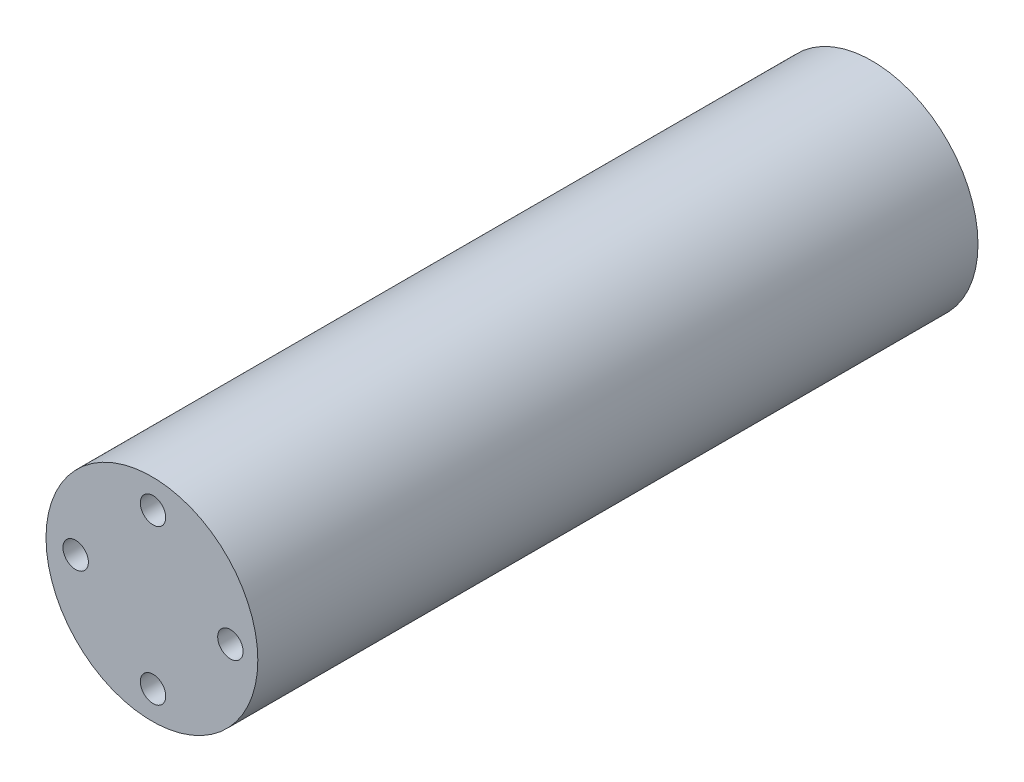
from build123d import *

# Parameters (mm, degrees)
SKETCH_1_R               = 25
EXTRUDE_2_DEPTH          = 170
SKETCH_2_R               = 3
CUT_EXTRUDE_1_DEPTH      = 10
PATTERN_CIRCULAR_1_COUNT = 4
MIRROR_1_OUTLINE_R       = 3
MIRROR_1_DEPTH           = 10
SKETCH_3_R               = 3
CUT_EXTRUDE_2_DEPTH      = 50


# Read off the part's stored shape, not the designer's step: 镜向1
with BuildPart() as part:
    # 草图1 → 凸台-拉伸2 (new body)
    with BuildSketch(Plane.XY):
        Circle(SKETCH_1_R)
    extrude(amount=EXTRUDE_2_DEPTH)

    # 草图2 → 切除-拉伸1 (cut)
    with BuildSketch(Plane.XY.offset(170)):
        with Locations((-18, 0)):
            Circle(SKETCH_2_R)
    cut_extrude_1 = extrude(amount=-CUT_EXTRUDE_1_DEPTH, mode=Mode.SUBTRACT)

    # 阵列(圆周)1: 切除-拉伸1 ×4 about axis
    pattern_circular_1_axis = Axis((0.262987013, 0, 0), (0, 0, 1))
    for i in range(1, PATTERN_CIRCULAR_1_COUNT):
        add(cut_extrude_1.rotate(pattern_circular_1_axis, i * 360 / PATTERN_CIRCULAR_1_COUNT), mode=Mode.SUBTRACT)

    # 镜向1 outline → 镜向1 (cut)
    with BuildSketch(Plane.XY):
        with Locations((-18, 0)):
            Circle(MIRROR_1_OUTLINE_R)
        with Locations((-0.016073909, 17.983926091)):
            Circle(MIRROR_1_OUTLINE_R)
        with Locations((17.967852182, 0)):
            Circle(MIRROR_1_OUTLINE_R)
        with Locations((-0.016073909, -17.983926091)):
            Circle(MIRROR_1_OUTLINE_R)
    extrude(amount=MIRROR_1_DEPTH, mode=Mode.SUBTRACT)

    # 草图3 → 切除-拉伸2 (cut)
    with BuildSketch(Plane(origin=(0, 0, 0), x_dir=(0, 0, -1), z_dir=(1, 0, 0))):
        with Locations((-85, 0)):
            Circle(SKETCH_3_R)
        with Locations((-85, 15)):
            Circle(SKETCH_3_R)
        with Locations((-85, -15)):
            Circle(SKETCH_3_R)
    extrude(amount=-CUT_EXTRUDE_2_DEPTH, mode=Mode.SUBTRACT)


solid = part.part
